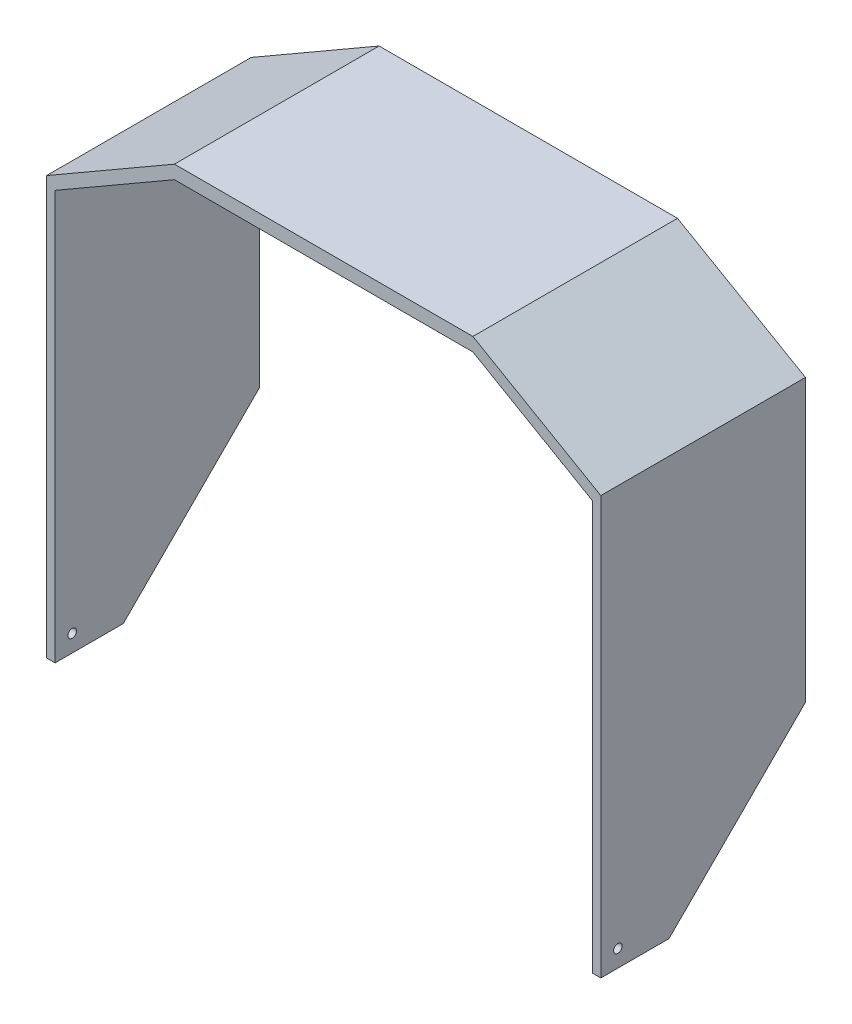
from build123d import *

# Parameters (mm, degrees)
BOSS_EXTRUDE2_DEPTH     = 120
CUT_EXTRUDE2_DEPTH      = 422.455810258
CUT_EXTRUDE2_DEPTH_BACK = 422.455810258
SKETCH5_R               = 2.5


with BuildPart() as part:
    # Sketch3 → Boss-Extrude2 (new body)
    with BuildSketch(Plane.XY):
        Polygon((-5, 5), (-5, -240), (0, -240), (0, 0), (70, 40.414518843), (245, 40.414518843), (315, 0), (315, -240), (320, -240), (320, 5), (245, 48.301270189), (70, 48.301270189), align=None)
    extrude(amount=BOSS_EXTRUDE2_DEPTH)

    # Sketch5 → Cut-Extrude2 (cut, two sides: drawn at the far end of the back side and taken through both)
    with BuildSketch(Plane(origin=(320, 0, 0), x_dir=(0, 0, -1), z_dir=(1, 0, 0)).offset(-CUT_EXTRUDE2_DEPTH_BACK)):
        with Locations((-110, -230)):
            Circle(SKETCH5_R)
        Polygon((-80, -240), (0, -160), (0, -240), align=None)
    extrude(amount=CUT_EXTRUDE2_DEPTH + CUT_EXTRUDE2_DEPTH_BACK, mode=Mode.SUBTRACT)


solid = part.part
